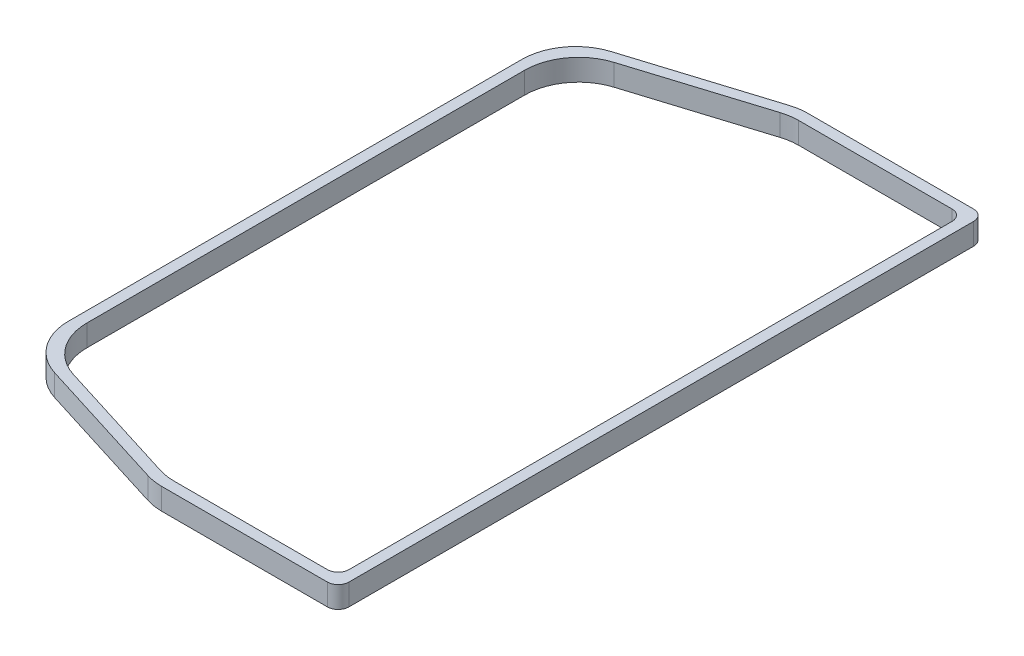
from build123d import *

# Parameters (mm, degrees)
EXTRUDE_1_DEPTH        = 2
FILLET_1_R             = 5
FILLET_2_R             = 1
FILLET_1_OF_MIRROR_1_R = 5
FILLET_2_OF_MIRROR_1_R = 1


with BuildPart() as part:
    # 草图1 → 凸台-拉伸1 (new body)
    with BuildSketch(Plane(origin=(0, 0, 0), x_dir=(1, 0, 0), z_dir=(0, 1, 0))):
        Polygon((0, 0), (0, 29), (-16, 29), (-32, 24), (-32, 0), (-33, 0), (-33, 24.735190913), (-16.152610923, 30), (1, 30), (1, 0), align=None)
    extrude_1 = extrude(amount=EXTRUDE_1_DEPTH)

    # 圆角1
    fillet_1_edges = [part.edges().sort_by_distance(p)[0] for p in [
        (-16, 1, -29),
        (-16.152610923, 1, -30),
        (-33, 1, -24.735190913),
        (-32, 1, -24),
    ]]
    fillet(fillet_1_edges, radius=FILLET_1_R)

    # 圆角2
    fillet_2_edges = [part.edges().sort_by_distance(p)[0] for p in [
        (1, 1, -30),
        (0, 1, -29),
    ]]
    fillet(fillet_2_edges, radius=FILLET_2_R)

    # 镜向1: 凸台-拉伸1 across plane
    add(extrude_1.mirror(Plane.XY))

    # 圆角1 of 镜向1
    fillet_1_of_mirror_1_edges = [part.edges().sort_by_distance(p)[0] for p in [
        (-16, 1, 29),
        (-16.152610923, 1, 30),
        (-33, 1, 24.735190913),
        (-32, 1, 24),
    ]]
    fillet(fillet_1_of_mirror_1_edges, radius=FILLET_1_OF_MIRROR_1_R)

    # 圆角2 of 镜向1
    fillet_2_of_mirror_1_edges = [part.edges().sort_by_distance(p)[0] for p in [
        (1, 1, 30),
        (0, 1, 29),
    ]]
    fillet(fillet_2_of_mirror_1_edges, radius=FILLET_2_OF_MIRROR_1_R)


solid = part.part
